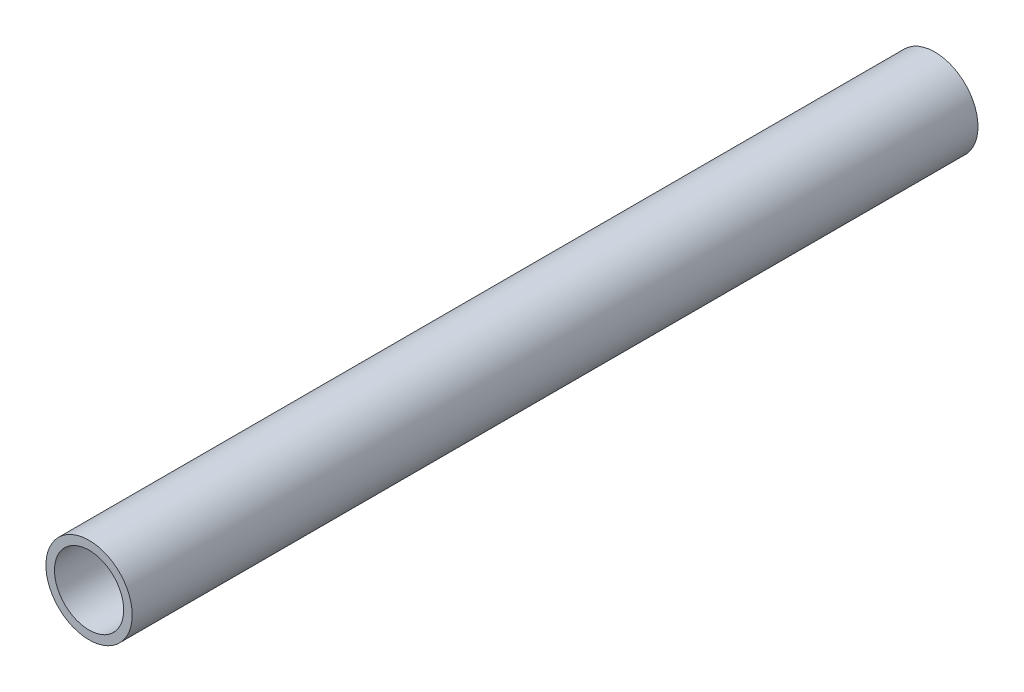
from build123d import *

# Parameters (mm, degrees)
SKETCH1_R           = 5.05
SKETCH1_R_2         = 4.05
EXTRUDE_THIN1_DEPTH = 99


with BuildPart() as part:
    # Sketch1 → Extrude-Thin1 (new body)
    with BuildSketch(Plane.XY):
        Circle(SKETCH1_R)
        Circle(SKETCH1_R_2, mode=Mode.SUBTRACT)
    extrude(amount=EXTRUDE_THIN1_DEPTH)


solid = part.part
